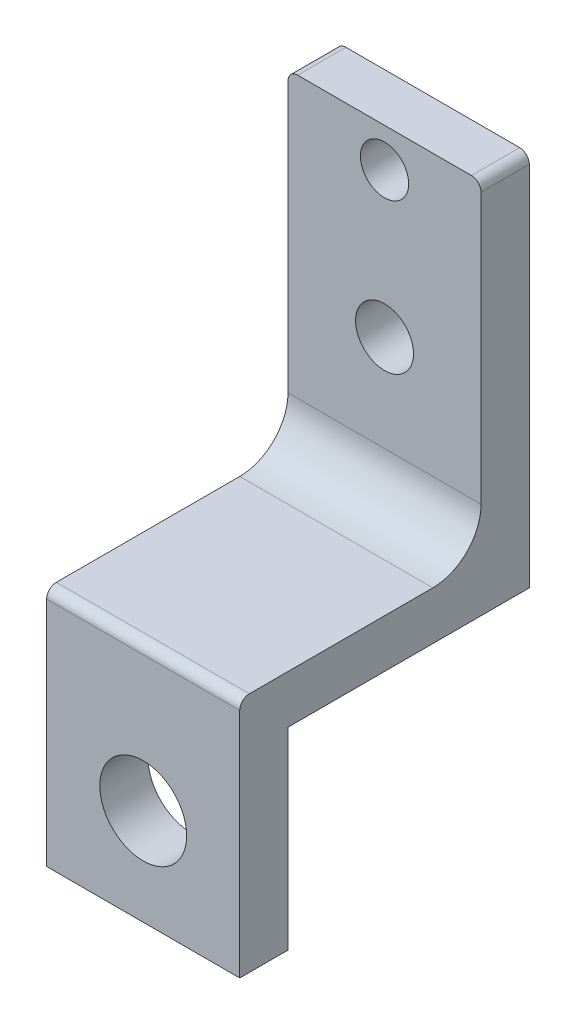
from build123d import *

# Parameters (mm, degrees)
SKETCH1_R           = 4.5
BOSS_EXTRUDE1_DEPTH = 5
SKETCH2_W           = 20
SKETCH2_H           = 39
BOSS_EXTRUDE2_DEPTH = 25
CUT_EXTRUDE1_DEPTH  = 30
SKETCH4_R           = 2.5
SKETCH4_R_2         = 3
CUT_EXTRUDE2_DEPTH  = 30
FILLET1_R           = 5
FILLET2_R           = 1


with BuildPart() as part:
    # Sketch1 → Boss-Extrude1 (new body)
    with BuildSketch(Plane.XY):
        Polygon((-10, 10), (-10, -10), (10, -10), (10, 10), (10, 49), (-10, 49), align=None)
        Circle(SKETCH1_R, mode=Mode.SUBTRACT)
    extrude(amount=BOSS_EXTRUDE1_DEPTH)

    # Sketch2 → Boss-Extrude2 (add)
    with BuildSketch(Plane(origin=(0, 0, 0), x_dir=(-1, 0, 0), z_dir=(0, 0, -1))):
        with Locations((0, 29.5)):
            Rectangle(SKETCH2_W, SKETCH2_H)
    extrude(amount=BOSS_EXTRUDE2_DEPTH)

    # Sketch3 → Cut-Extrude1 (cut)
    with BuildSketch(Plane(origin=(10, 0, 0), x_dir=(0, 0, -1), z_dir=(1, 0, 0))):
        Polygon((0, 15), (-5, 15), (-5, 49), (20, 49), (20, 15), align=None)
    extrude(amount=-CUT_EXTRUDE1_DEPTH, mode=Mode.SUBTRACT)

    # Sketch4 → Cut-Extrude2 (cut)
    with BuildSketch(Plane.XY.offset(-20)):
        with Locations((0, 45)):
            Circle(SKETCH4_R)
        with Locations((0, 30)):
            Circle(SKETCH4_R_2)
    extrude(amount=-CUT_EXTRUDE2_DEPTH, mode=Mode.SUBTRACT)

    # Fillet1
    fillet1_edges = [part.edges().sort_by_distance(p)[0] for p in [
        (0, 15, -20),
    ]]
    fillet(fillet1_edges, radius=FILLET1_R)

    # Fillet2
    fillet2_edges = [part.edges().sort_by_distance(p)[0] for p in [
        (0, 15, 5),
        (-10, 49, -22.5),
        (10, 49, -22.5),
    ]]
    fillet(fillet2_edges, radius=FILLET2_R)


solid = part.part
